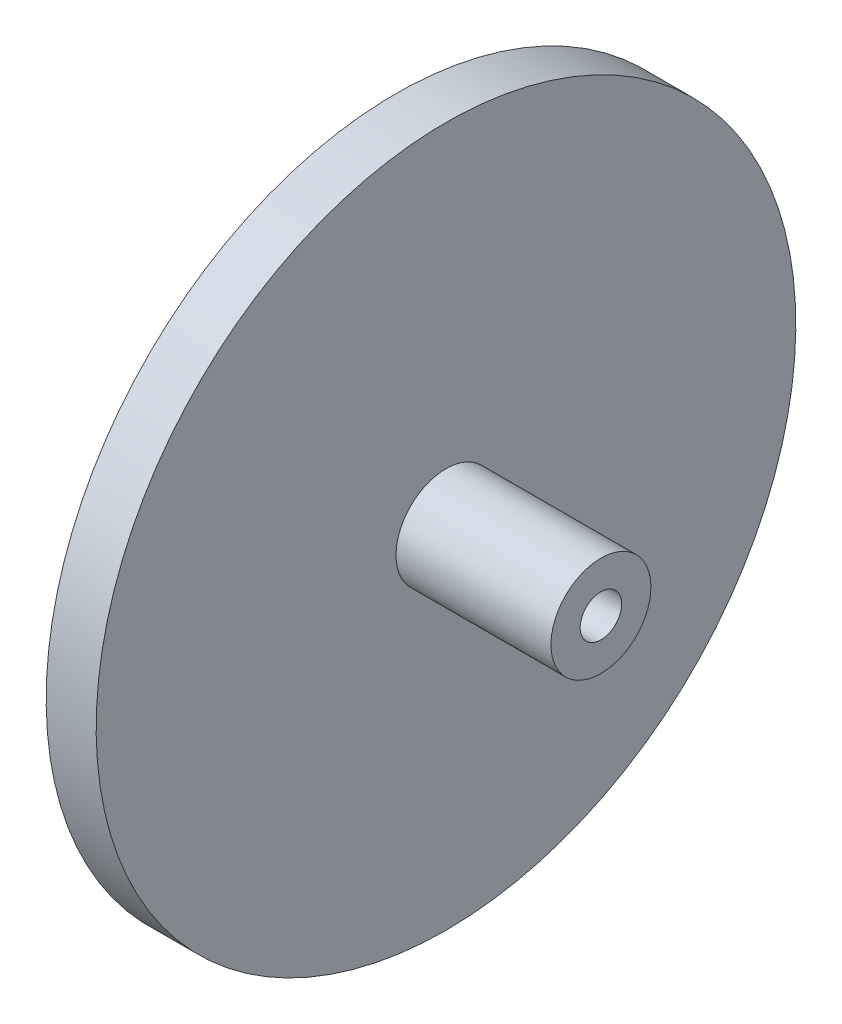
from build123d import *

# Parameters (mm, degrees)
SKETCH3_R          = 2.6416
CUT_EXTRUDE1_DEPTH = 69.039887015


with BuildPart() as part:
    # Sketch2 → Revolve1 (revolve)
    with BuildSketch(Plane.XY):
        Polygon((41.91, 44.45), (48.26, 44.45), (48.26, 6.35), (67.945, 6.35), (67.945, 0), (41.91, 0), align=None)
    revolve(axis=Axis((41.91, 0, 0), (1, 0, 0)))

    # Sketch3 → Cut-Extrude1 (cut, through all)
    with BuildSketch(Plane(origin=(67.945, 0, 0), x_dir=(0, 0, -1), z_dir=(1, 0, 0))):
        Circle(SKETCH3_R)
    extrude(amount=-CUT_EXTRUDE1_DEPTH, mode=Mode.SUBTRACT)


solid = part.part
